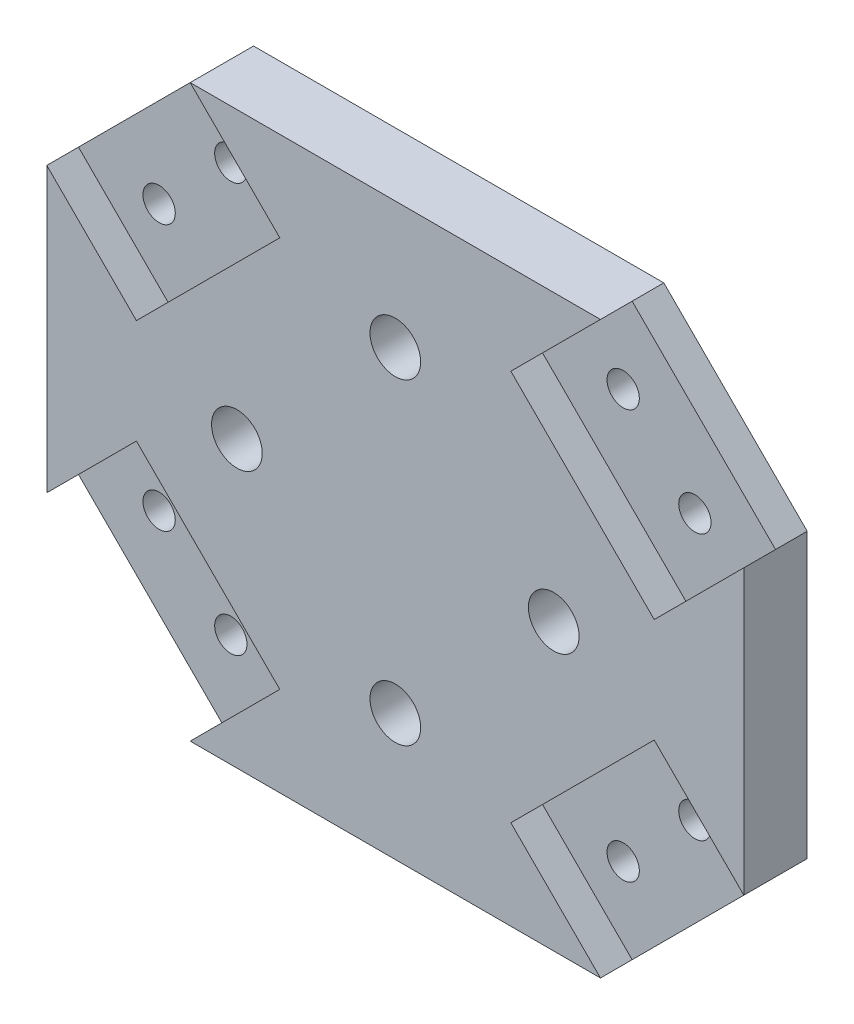
from build123d import *

# Parameters (mm, degrees)
ESQUISSE1_R                                = 4
BOSS_EXTRU_1_DEPTH                         = 10
ENL_V_MAT_EXTRU_1_DEPTH                    = 5
ESQUISSE4_R                                = 2.55
ENL_V_MAT_EXTRU_2_DEPTH                    = 72.239034244
SYM_TRIE1_AT_THE_SECOND_PLANE_COPY_1_DEPTH = 5
SYM_TRIE1_AT_THE_SECOND_PLANE_COPY_2_SKE_R = 2.55
SYM_TRIE1_AT_THE_SECOND_PLANE_COPY_2_DEPTH = 72.239034244


with BuildPart() as part:
    # Esquisse1 → Boss.-Extru.1 (new body)
    with BuildSketch(Plane.XY):
        Polygon((-32.372583002, 45), (-55, 22.372583002), (-55, -22.372583002), (-32.372583002, -45), (32.372583002, -45), (55, -22.372583002), (55, 22.372583002), (32.372583002, 45), align=None)
        with Locations((0, -25)):
            Circle(ESQUISSE1_R, mode=Mode.SUBTRACT)
        with Locations((25, 0)):
            Circle(ESQUISSE1_R, mode=Mode.SUBTRACT)
        with Locations((-25, 0)):
            Circle(ESQUISSE1_R, mode=Mode.SUBTRACT)
        with Locations((0, 25)):
            Circle(ESQUISSE1_R, mode=Mode.SUBTRACT)
    extrude(amount=BOSS_EXTRU_1_DEPTH)

    # Esquisse3 → Enlèv. mat.-Extru.1 (cut)
    with BuildSketch(Plane.XY.offset(10)):
        Polygon((-55, 22.372583002), (-32.372583002, 45), (-18.230447378, 30.857864376), (-40.857864376, 8.230447378), align=None)
    enl_v_mat_extru_1 = extrude(amount=-ENL_V_MAT_EXTRU_1_DEPTH, mode=Mode.SUBTRACT)

    # Esquisse4 → Enlèv. mat.-Extru.2 (cut, through all)
    with BuildSketch(Plane.XY.offset(5)):
        with Locations((-42.272077939, 20.95836944)):
            Circle(ESQUISSE4_R)
        with Locations((-30.95836944, 32.272077939)):
            Circle(ESQUISSE4_R)
    enl_v_mat_extru_2 = extrude(amount=-ENL_V_MAT_EXTRU_2_DEPTH, mode=Mode.SUBTRACT)

    # Symétrie1: Enlèv. mat.-Extru.1, Enlèv. mat.-Extru.2 across plane
    add(enl_v_mat_extru_1.mirror(Plane(origin=(0, 0, 0), x_dir=(0, 0, 1), z_dir=(1, 0, 0))), mode=Mode.SUBTRACT)
    add(enl_v_mat_extru_2.mirror(Plane(origin=(0, 0, 0), x_dir=(0, 0, 1), z_dir=(1, 0, 0))), mode=Mode.SUBTRACT)

    # Symétrie1 at the second plane: Enlèv. mat.-Extru.1, Enlèv. mat.-Extru.2 across plane
    add(enl_v_mat_extru_1.mirror(Plane.ZX), mode=Mode.SUBTRACT)
    add(enl_v_mat_extru_2.mirror(Plane.ZX), mode=Mode.SUBTRACT)

    # Symétrie1 at the second plane copy 1 ske → Symétrie1 at the second plane copy 1 (cut)
    with BuildSketch(Plane(origin=(0, 0, 10), x_dir=(-1, 0, 0), z_dir=(0, 0, 1))):
        Polygon((-55, 22.372583002), (-32.372583002, 45), (-18.230447378, 30.857864376), (-40.857864376, 8.230447378), align=None)
    extrude(amount=-SYM_TRIE1_AT_THE_SECOND_PLANE_COPY_1_DEPTH, mode=Mode.SUBTRACT)

    # Symétrie1 at the second plane copy 2 ske → Symétrie1 at the second plane copy 2 (cut, through all)
    with BuildSketch(Plane(origin=(0, 0, 5), x_dir=(-1, 0, 0), z_dir=(0, 0, 1))):
        with Locations((-42.272077939, 20.95836944)):
            Circle(SYM_TRIE1_AT_THE_SECOND_PLANE_COPY_2_SKE_R)
        with Locations((-30.95836944, 32.272077939)):
            Circle(SYM_TRIE1_AT_THE_SECOND_PLANE_COPY_2_SKE_R)
    extrude(amount=-SYM_TRIE1_AT_THE_SECOND_PLANE_COPY_2_DEPTH, mode=Mode.SUBTRACT)


solid = part.part
